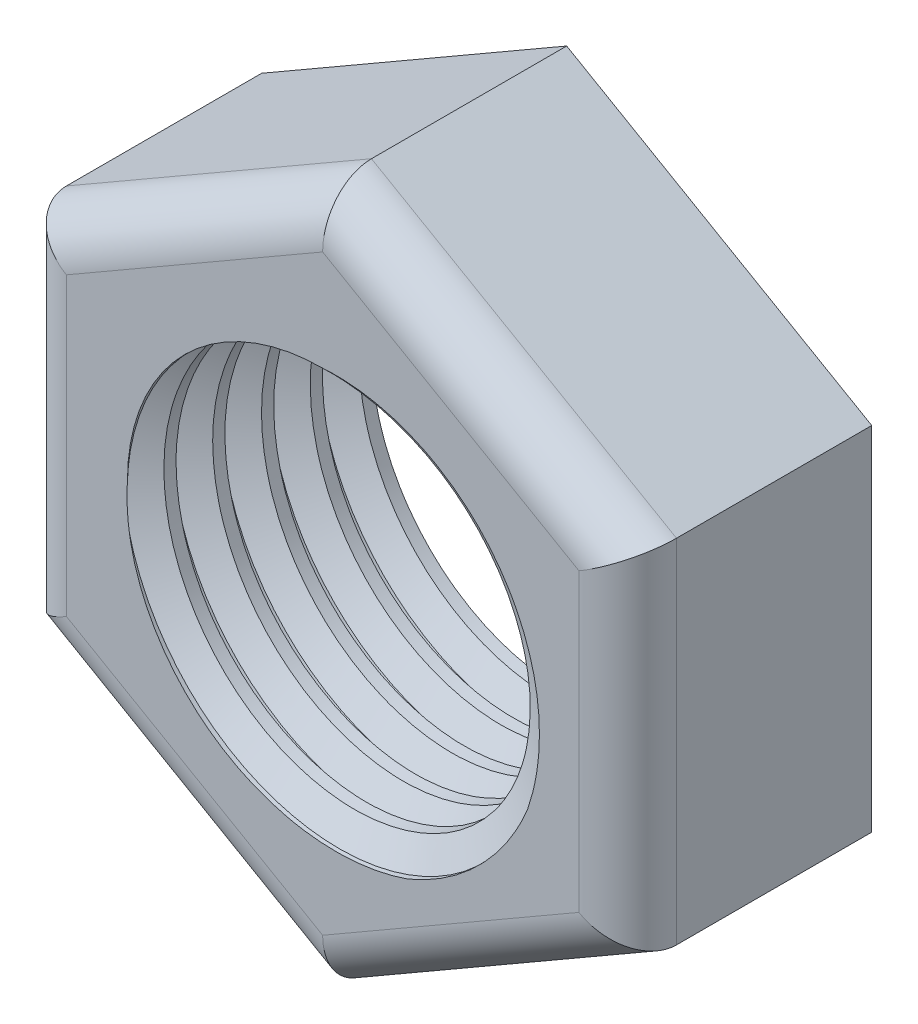
from build123d import *

# Parameters (mm, degrees)
SKETCH1_R           = 8
BOSS_EXTRUDE2_DEPTH = 10
THREAD1_PITCH       = 2
FILLET3_R           = 2


with BuildPart() as part:
    # Sketch1 → Boss-Extrude2 (new body)
    with BuildSketch(Plane.XY):
        Polygon((0, -14.43375673), (12.5, -7.216878365), (12.5, 7.216878365), (0, 14.43375673), (-12.5, 7.216878365), (-12.5, -7.216878365), align=None)
        Circle(SKETCH1_R, mode=Mode.SUBTRACT)
    extrude(amount=BOSS_EXTRUDE2_DEPTH)

    # Thread1: arcs per turn and ends read off the stored shape
    # Thread1: the profile of Thread Profile2 profile screwed along a right-hand helix through 6 turns, 10 arcs to a turn; built about Z, then put on its axis
    thread1_z = Axis((0, 0, 0), (0, 0, 1))
    thread1_corners = [(7.9997, 0, -12.000173205), (9.08253175, 0, -11.375000003), (9.08253175, 0, -11.125000003), (7.9997, 0, -10.4998268)]
    with BuildLine(mode=Mode.PRIVATE) as thread1_profile:
        Line(thread1_corners[0], thread1_corners[1])
        Line(thread1_corners[1], thread1_corners[2])
        Line(thread1_corners[2], thread1_corners[3])
        Line(thread1_corners[3], thread1_corners[0])
    thread1_cap = Face(thread1_profile.wire())
    thread1_turn_angles = [0, 18, 36, 54, 72, 90, 108, 126, 144, 162, 180, 198, 216, 234, 252, 270, 288, 306, 324, 342, 360]
    thread1_turn_weights = [1, 0.9510565162951535, 1, 0.9510565162951535, 1, 0.9510565162951535, 1, 0.9510565162951535, 1, 0.9510565162951535, 1, 0.9510565162951535, 1, 0.9510565162951535, 1, 0.9510565162951535, 1, 0.9510565162951535, 1, 0.9510565162951535, 1]
    thread1_turn_rails = [Edge.make_bspline([Vector(p[0], p[1], 0).rotate(thread1_z, thread1_turn_angles[k]) / thread1_turn_weights[k] + Vector(0, 0, p[2] + THREAD1_PITCH * thread1_turn_angles[k] / 360) for k in range(21)], [0, 0, 0, 1, 1, 2, 2, 3, 3, 4, 4, 5, 5, 6, 6, 7, 7, 8, 8, 9, 9, 10, 10, 10], 2, thread1_turn_weights) for p in thread1_corners]
    thread1_turn_sides = [Face.make_surface_from_curves(thread1_turn_rails[p[0]], thread1_turn_rails[p[1]]) for p in [(0, 1), (1, 2), (2, 3), (3, 0)]]
    thread1 = Plane(origin=(0, 0, 0), x_dir=(-1, 0, 0), z_dir=(0, 0, -1)) * Solid(Shell([*[p.moved(Location((0, 0, THREAD1_PITCH * i))) for i in range(6) for p in thread1_turn_sides], thread1_cap, thread1_cap.rotate(thread1_z, 2160).moved(Location((0, 0, THREAD1_PITCH * 2160 / 360)))]))
    add(thread1, mode=Mode.SUBTRACT)

    # Fillet3
    fillet3_edges = [part.edges().sort_by_distance(p)[0] for p in [
        (12.5, 0, 10),
        (6.25, 10.825317547, 10),
        (-6.25, 10.825317547, 10),
        (-12.5, 0, 10),
        (-6.25, -10.825317547, 10),
        (6.25, -10.825317547, 10),
    ]]
    fillet(fillet3_edges, radius=FILLET3_R)


solid = part.part
